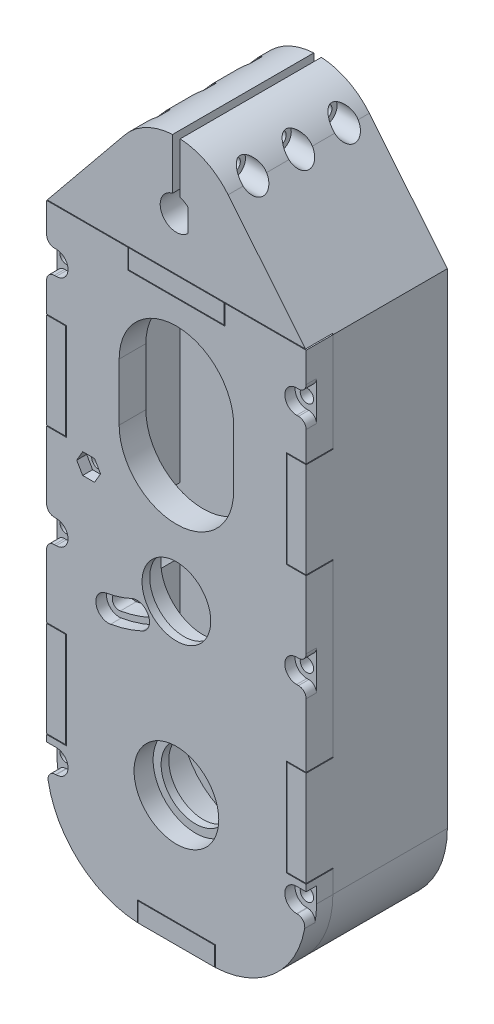
from build123d import *

# Parameters (mm, degrees)
SKETCH1_W                = 42
SKETCH1_H                = 42
BOSS_EXTRUDE1_DEPTH      = 7
SKETCH3_W                = 68
SKETCH3_H                = 152
SKETCH3_W_2              = 58
SKETCH3_H_2              = 142
BOSS_EXTRUDE2_DEPTH      = 30
CUT_EXTRUDE2_REACH       = 134.518
SKETCH4_R                = 9
SKETCH4_5_R              = 11.1
CUT_EXTRUDE3_DEPTH       = 5
CUT_EXTRUDE23_START      = 2
SKETCH4_7_R              = 11.1
SKETCH4_7_R_2            = 9
CUT_EXTRUDE23_DEPTH      = 131.517923316
SKETCH5_W                = 5
SKETCH5_H                = 25
SKETCH5_W_2              = 20
SKETCH5_H_2              = 5
SKETCH5_W_3              = 25
BOSS_EXTRUDE4_DEPTH      = 7
BOSS_EXTRUDE5_DEPTH      = 7
SKETCH8_R                = 9
CUT_EXTRUDE4_DEPTH       = 7
SKETCH8_3_R              = 11.1
SKETCH8_3_R_2            = 9
CUT_EXTRUDE5_DEPTH       = 5
CUT_EXTRUDE6_START       = -2
SKETCH8_4_R              = 11.1
SKETCH8_4_R_2            = 9
CUT_EXTRUDE6_DEPTH       = 5
SKETCH9_R                = 1.8
CUT_EXTRUDE7_DEPTH       = 7
CUT_EXTRUDE8_DEPTH       = 2.8
CUT_EXTRUDE9_DEPTH       = 2.6
CUT_EXTRUDE10_DEPTH      = 23
FILLET4_R                = 18
FILLET3_R                = 25
FILLET5_R                = 25
SKETCH14_R               = 1.75
CUT_EXTRUDE11_DEPTH      = 2.7
SKETCH14_2_R             = 1.75
CUT_EXTRUDE12_DEPTH      = 7
SKETCH15_R               = 1.5
CUT_EXTRUDE13_DEPTH      = 16
CUT_EXTRUDE14_DEPTH      = 7
FILLET6_R                = 2
BOSS_EXTRUDE12_DEPTH     = 29.9
BOSS_EXTRUDE13_DEPTH     = 7.1
BOSS_EXTRUDE14_START     = -37
BOSS_EXTRUDE14_DEPTH     = 37
CUT_EXTRUDE17_DEPTH      = 136.650285661
CUT_EXTRUDE17_DEPTH_BACK = 136.650285661
SKETCH23_R               = 1.75
CUT_EXTRUDE18_START      = 8
SKETCH23_3_R             = 3.1
SKETCH23_3_R_2           = 1.75
CUT_EXTRUDE18_DEPTH      = 128.650285689
CUT_EXTRUDE19_START      = -9
CUT_EXTRUDE19_DEPTH      = 127.650285689


with BuildPart() as part:
    # Sketch1 → Boss-Extrude1 (new body)
    # profile 1 of 2: a face of its own
    with BuildSketch(Plane.XY):
        Polygon((21, -21), (-21, -21), (-21, 21), (-29, 21), (-29, -121), (29, -121), (29, 21), (21, 21), align=None)
    # profile 2 of 2: a face of its own
    with BuildSketch(Plane.XY):
        Rectangle(SKETCH1_W, SKETCH1_H)
        with BuildLine():
            ThreePointArc((11.1, 3.5), (0, 14.6), (-11.1, 3.5))
            Line((-11.1, 3.5), (-11.1, -3.5))
            ThreePointArc((-11.1, -3.5), (0, -14.6), (11.1, -3.5))
            Line((11.1, -3.5), (11.1, 3.5))
        make_face(mode=Mode.SUBTRACT)
        with BuildLine():
            ThreePointArc((17.3, -12), (15.5, -10.2), (13.7, -12))
            Line((13.7, -12), (13.7, -19))
            ThreePointArc((13.7, -19), (15.5, -20.8), (17.3, -19))
            Line((17.3, -19), (17.3, -12))
        make_face(mode=Mode.SUBTRACT)
        with BuildLine():
            ThreePointArc((-13.7, -12), (-15.5, -10.2), (-17.3, -12))
            Line((-17.3, -12), (-17.3, -19))
            ThreePointArc((-17.3, -19), (-15.5, -20.8), (-13.7, -19))
            Line((-13.7, -19), (-13.7, -12))
        make_face(mode=Mode.SUBTRACT)
        with BuildLine():
            ThreePointArc((-13.7, 19), (-15.5, 20.8), (-17.3, 19))
            Line((-17.3, 19), (-17.3, 12))
            ThreePointArc((-17.3, 12), (-15.5, 10.2), (-13.7, 12))
            Line((-13.7, 12), (-13.7, 19))
        make_face(mode=Mode.SUBTRACT)
        with BuildLine():
            ThreePointArc((17.3, 19), (15.5, 20.8), (13.7, 19))
            Line((13.7, 19), (13.7, 12))
            ThreePointArc((13.7, 12), (15.5, 10.2), (17.3, 12))
            Line((17.3, 12), (17.3, 19))
        make_face(mode=Mode.SUBTRACT)
    extrude(amount=BOSS_EXTRUDE1_DEPTH)

    # Sketch3 → Boss-Extrude2 (add)
    with BuildSketch(Plane.XY):
        with Locations((0, -50)):
            Rectangle(SKETCH3_W, SKETCH3_H)
        with Locations((0, -50)):
            Rectangle(SKETCH3_W_2, SKETCH3_H_2, mode=Mode.SUBTRACT)
    extrude(amount=BOSS_EXTRUDE2_DEPTH)

    # Sketch4 → Cut-Extrude2 (cut, up to next)
    with BuildSketch(Plane(origin=(0, 0, 7), x_dir=(-1, 0, 0), z_dir=(0, 0, -1)), mode=Mode.PRIVATE) as cut_extrude2_sk1:
        with Locations(Location((0, -92, 0), (0, 0, 180))):
            Circle(SKETCH4_R)
    cut_extrude2_tool1 = extrude(cut_extrude2_sk1.sketch, amount=CUT_EXTRUDE2_REACH, mode=Mode.PRIVATE) & part.part
    # Sketch4 → Cut-Extrude2 (cut, up to next)
    with BuildSketch(Plane(origin=(0, 0, 7), x_dir=(-1, 0, 0), z_dir=(0, 0, -1)), mode=Mode.PRIVATE) as cut_extrude2_sk2:
        with Locations(Location((0, -48, 0), (0, 0, 180))):
            Circle(SKETCH4_R)
    cut_extrude2_tool2 = extrude(cut_extrude2_sk2.sketch, amount=CUT_EXTRUDE2_REACH, mode=Mode.PRIVATE) & part.part
    add(cut_extrude2_tool1.solids().sort_by_distance((0, -92, 7))[0], mode=Mode.SUBTRACT)
    add(cut_extrude2_tool2.solids().sort_by_distance((0, -48, 7))[0], mode=Mode.SUBTRACT)

    # Sketch4<5> → Cut-Extrude3 (cut)
    with BuildSketch(Plane(origin=(0, 0, 7), x_dir=(-1, 0, 0), z_dir=(0, 0, -1))):
        with Locations((0, -48)):
            Circle(SKETCH4_5_R)
    extrude(amount=CUT_EXTRUDE3_DEPTH, mode=Mode.SUBTRACT)

    # Sketch4<7> → Cut-Extrude23 (cut, through all)
    with BuildSketch(Plane(origin=(0, 0, 7), x_dir=(-1, 0, 0), z_dir=(0, 0, -1)).offset(CUT_EXTRUDE23_START)):
        with Locations(Location((0, -92, 0), (0, 0, 180))):
            Circle(SKETCH4_7_R)
        with Locations(Location((0, -92, 0), (0, 0, 180))):
            Circle(SKETCH4_7_R_2, mode=Mode.SUBTRACT)
    extrude(amount=CUT_EXTRUDE23_DEPTH, mode=Mode.SUBTRACT)

    # Sketch5 → Boss-Extrude4 (add)
    with BuildSketch(Plane.XY.offset(30)):
        with Locations((-31.5, -12.5)):
            Rectangle(SKETCH5_W, SKETCH5_H)
        with Locations((-31.5, -82.5)):
            Rectangle(SKETCH5_W, SKETCH5_H)
        with Locations((0, -123.5)):
            Rectangle(SKETCH5_W_2, SKETCH5_H_2)
        with Locations((31.5, -82.5)):
            Rectangle(SKETCH5_W, SKETCH5_H)
        with Locations((31.5, -12.5)):
            Rectangle(SKETCH5_W, SKETCH5_H)
        with Locations((0, 23.5)):
            Rectangle(SKETCH5_W_3, SKETCH5_H_2)
    extrude(amount=BOSS_EXTRUDE4_DEPTH)

    # Sketch12 → Cut-Extrude10 (cut)
    with BuildSketch(Plane.XY.offset(30)):
        with BuildLine():
            Line((-29, -50.5), (-29, -67.5))
            ThreePointArc((-29, -67.5), (-33.017879978, -59), (-29, -50.5))
        make_face()
    extrude(amount=-CUT_EXTRUDE10_DEPTH, mode=Mode.SUBTRACT)

    # Fillet4
    fillet4_edges = [part.edges().sort_by_distance(p)[0] for p in [
        (-29, -121, 18.5),
        (29, -121, 18.5),
    ]]
    fillet(fillet4_edges, radius=FILLET4_R)

    # Fillet3
    fillet3_edges = [part.edges().sort_by_distance(p)[0] for p in [
        (34, -126, 15),
        (-34, -126, 15),
    ]]
    fillet(fillet3_edges, radius=FILLET3_R)

    # Sketch15 → Cut-Extrude13 (cut)
    with BuildSketch(Plane.XY.offset(37)):
        with Locations((31.5, 13.1)):
            Circle(SKETCH15_R)
        with Locations((31.5, -48)):
            Circle(SKETCH15_R)
        with Locations((31.5, -100)):
            Circle(SKETCH15_R)
        with Locations((-31.5, -100)):
            Circle(SKETCH15_R)
        with Locations((-31.5, -48)):
            Circle(SKETCH15_R)
        with Locations((-31.5, 13.1)):
            Circle(SKETCH15_R)
    extrude(amount=-CUT_EXTRUDE13_DEPTH, mode=Mode.SUBTRACT)

    # Sketch20 → Boss-Extrude12 (add)
    with BuildSketch(Plane.XY):
        with BuildLine():
            ThreePointArc((-1, 57.47140521), (-7.955221873, 55.587316798), (-13.561630346, 51.060387984))
            ThreePointArc((-13.561630346, 51.060387984), (-17.370845552, 37.877801895), (-10.5, 26))
            Line((-10.5, 26), (10.5, 26))
            ThreePointArc((10.5, 26), (15.652475842, 32.173762079), (17.5, 40))
            ThreePointArc((17.5, 40), (16.486032437, 45.870326607), (13.561630346, 51.060387984))
            ThreePointArc((13.561630346, 51.060387984), (7.955221873, 55.587316798), (1, 57.47140521))
            Line((1, 57.47140521), (1, 44.13067791))
            ThreePointArc((1, 44.13067791), (3.340097304, 42.627974505), (4.25, 40))
            ThreePointArc((4.25, 40), (-2.627974505, 36.659902696), (-1, 44.13067791))
            Line((-1, 44.13067791), (-1, 57.47140521))
        make_face()
        with BuildLine():
            ThreePointArc((17.5, 40), (15.652475842, 32.173762079), (10.5, 26))
            Line((10.5, 26), (34, 26))
            Line((34, 26), (13.561630346, 51.060387984))
            ThreePointArc((13.561630346, 51.060387984), (16.486032437, 45.870326607), (17.5, 40))
        make_face()
        with BuildLine():
            Line((-13.561630346, 51.060387984), (-34, 26))
            Line((-34, 26), (-10.5, 26))
            ThreePointArc((-10.5, 26), (-17.370845552, 37.877801895), (-13.561630346, 51.060387984))
        make_face()
    extrude(amount=BOSS_EXTRUDE12_DEPTH)

    # Sketch21 → Boss-Extrude13 (add)
    with BuildSketch(Plane.XY.offset(29.9)):
        with BuildLine():
            Line((-33.836887045, 26.2), (33.836887045, 26.2))
            Line((33.836887045, 26.2), (13.561630346, 51.060387984))
            ThreePointArc((13.561630346, 51.060387984), (7.955221873, 55.587316798), (1, 57.47140521))
            Line((1, 57.47140521), (1, 44.13067791))
            ThreePointArc((1, 44.13067791), (0, 35.75), (-1, 44.13067791))
            Line((-1, 44.13067791), (-1, 57.47140521))
            ThreePointArc((-1, 57.47140521), (-7.955221873, 55.587316798), (-13.561630346, 51.060387984))
            Line((-13.561630346, 51.060387984), (-33.836887045, 26.2))
        make_face()
    extrude(amount=BOSS_EXTRUDE13_DEPTH)

    # Sketch22 → Boss-Extrude14 (add)
    with BuildSketch(Plane.XY.offset(37).offset(BOSS_EXTRUDE14_START)):
        with BuildLine():
            ThreePointArc((4.25, 40), (3.925079617, 41.629800601), (3, 43.010398645))
            Line((3, 43.010398645), (3, 36.989601355))
            ThreePointArc((3, 36.989601355), (3.925079617, 38.370199399), (4.25, 40))
        make_face()
    extrude(amount=BOSS_EXTRUDE14_DEPTH)

    # Sketch23 → Cut-Extrude17 (cut, two sides: drawn at the far end of the back side and taken through both)
    with BuildSketch(Plane(origin=(0, 0, 0), x_dir=(0, 0, -1), z_dir=(1, 0, 0)).offset(-CUT_EXTRUDE17_DEPTH_BACK)):
        with Locations(Location((-30, 51.47140521, 0), (0, 0, 346.4162178))):
            Circle(SKETCH23_R)
        with Locations(Location((-18, 51.47140521, 0), (0, 0, 346.4162178))):
            Circle(SKETCH23_R)
        with Locations(Location((-6, 51.47140521, 0), (0, 0, 346.4162178))):
            Circle(SKETCH23_R)
    extrude(amount=CUT_EXTRUDE17_DEPTH + CUT_EXTRUDE17_DEPTH_BACK, mode=Mode.SUBTRACT)

    # Sketch23<3> → Cut-Extrude18 (cut, through all)
    # profile 1 of 3: a face of its own
    with BuildSketch(Plane(origin=(0, 0, 0), x_dir=(0, 0, -1), z_dir=(1, 0, 0)).offset(CUT_EXTRUDE18_START)):
        with Locations(Location((-30, 51.47140521, 0), (0, 0, 187.619064708))):
            Circle(SKETCH23_3_R)
        with Locations((-30, 51.47140521)):
            Circle(SKETCH23_3_R_2, mode=Mode.SUBTRACT)
    # profile 2 of 3: a face of its own
    with BuildSketch(Plane(origin=(0, 0, 0), x_dir=(0, 0, -1), z_dir=(1, 0, 0)).offset(CUT_EXTRUDE18_START)):
        with Locations(Location((-6, 51.47140521, 0), (0, 0, 187.619064708))):
            Circle(SKETCH23_3_R)
        with Locations((-6, 51.47140521)):
            Circle(SKETCH23_3_R_2, mode=Mode.SUBTRACT)
    # profile 3 of 3: a face of its own
    with BuildSketch(Plane(origin=(0, 0, 0), x_dir=(0, 0, -1), z_dir=(1, 0, 0)).offset(CUT_EXTRUDE18_START)):
        with Locations(Location((-18, 51.47140521, 0), (0, 0, 187.619064708))):
            Circle(SKETCH23_3_R)
        with Locations((-18, 51.47140521)):
            Circle(SKETCH23_3_R_2, mode=Mode.SUBTRACT)
    extrude(amount=CUT_EXTRUDE18_DEPTH, mode=Mode.SUBTRACT)

    # Sketch24 → Cut-Extrude19 (cut, through all)
    with BuildSketch(Plane(origin=(0, 0, 0), x_dir=(0, 0, -1), z_dir=(1, 0, 0)).offset(CUT_EXTRUDE19_START)):
        Polygon((-28.383419246, 54.27140521), (-31.616580754, 54.27140521), (-33.233161507, 51.47140521), (-31.616580754, 48.67140521), (-28.383419246, 48.67140521), (-26.766838493, 51.47140521), align=None)
        Polygon((-16.383419246, 54.27140521), (-19.616580754, 54.27140521), (-21.233161507, 51.47140521), (-19.616580754, 48.67140521), (-16.383419246, 48.67140521), (-14.766838493, 51.47140521), align=None)
        Polygon((-4.383419246, 54.27140521), (-7.616580754, 54.27140521), (-9.233161507, 51.47140521), (-7.616580754, 48.67140521), (-4.383419246, 48.67140521), (-2.766838493, 51.47140521), align=None)
    extrude(amount=-CUT_EXTRUDE19_DEPTH, mode=Mode.SUBTRACT)


with BuildPart() as body_2:
    # Sketch7 → Boss-Extrude5 (new body)
    with BuildSketch(Plane.XY.offset(30)):
        Polygon((-34, -126), (-10.2, -126), (-10.2, -120.8), (10.2, -120.8), (10.2, -126), (34, -126), (34, -95.2), (28.8, -95.2), (28.8, -69.8), (34, -69.8), (34, -25.2), (28.8, -25.2), (28.8, 0.2), (34, 0.2), (34, 26), (12.7, 26), (12.7, 20.8), (-12.7, 20.8), (-12.7, 26), (-34, 26), (-34, 0.2), (-28.8, 0.2), (-28.8, -25.2), (-34, -25.2), (-34, -69.8), (-28.8, -69.8), (-28.8, -95.2), (-34, -95.2), align=None)
    extrude(amount=BOSS_EXTRUDE5_DEPTH)

    # Sketch8 → Cut-Extrude4 (cut)
    with BuildSketch(Plane.XY.offset(37)):
        with Locations((0, -92)):
            Circle(SKETCH8_R)
        with Locations((0, -48)):
            Circle(SKETCH8_R)
    extrude(amount=-CUT_EXTRUDE4_DEPTH, mode=Mode.SUBTRACT)

    # Sketch8<3> → Cut-Extrude5 (cut)
    with BuildSketch(Plane.XY.offset(37)):
        with Locations((0, -92)):
            Circle(SKETCH8_3_R)
        with Locations((0, -92)):
            Circle(SKETCH8_3_R_2, mode=Mode.SUBTRACT)
    extrude(amount=-CUT_EXTRUDE5_DEPTH, mode=Mode.SUBTRACT)

    # Sketch8<4> → Cut-Extrude6 (cut)
    with BuildSketch(Plane.XY.offset(37).offset(CUT_EXTRUDE6_START)):
        with Locations((0, -48)):
            Circle(SKETCH8_4_R)
        with Locations((0, -48)):
            Circle(SKETCH8_4_R_2, mode=Mode.SUBTRACT)
    extrude(amount=-CUT_EXTRUDE6_DEPTH, mode=Mode.SUBTRACT)

    # Sketch9 → Cut-Extrude7 (cut)
    with BuildSketch(Plane.XY.offset(37)):
        with BuildLine():
            ThreePointArc((-17.501162862, -60.320964068), (-13.46, -59.335266605), (-9.582069183, -57.83052432))
            ThreePointArc((-9.582069183, -57.83052432), (-8.70965823, -55.439102331), (-11.101080218, -54.566691378))
            ThreePointArc((-11.101080218, -54.566691378), (-14.54, -55.90108548), (-18.123672727, -56.775194551))
            ThreePointArc((-18.123672727, -56.775194551), (-19.585302553, -58.859334242), (-17.501162862, -60.320964068))
        make_face()
        with Locations((-23, -29)):
            Circle(SKETCH9_R)
    extrude(amount=-CUT_EXTRUDE7_DEPTH, mode=Mode.SUBTRACT)

    # Sketch10 → Cut-Extrude8 (cut)
    with BuildSketch(Plane.XY.offset(37)):
        with BuildLine():
            ThreePointArc((-17.241783752, -61.798368033), (-13.01, -60.766175407), (-8.949147918, -59.190454713))
            ThreePointArc((-8.949147918, -59.190454713), (-7.349727837, -54.806181066), (-11.734001483, -53.206760986))
            ThreePointArc((-11.734001483, -53.206760986), (-14.99, -54.470176678), (-18.383051837, -55.297790585))
            ThreePointArc((-18.383051837, -55.297790585), (-21.062706519, -59.118713352), (-17.241783752, -61.798368033))
        make_face()
    extrude(amount=-CUT_EXTRUDE8_DEPTH, mode=Mode.SUBTRACT)

    # Sketch11 → Cut-Extrude9 (cut)
    with BuildSketch(Plane.XY.offset(37)):
        Polygon((-21.441154273, -26.3), (-24.558845727, -26.3), (-26.117691454, -29), (-24.558845727, -31.7), (-21.441154273, -31.7), (-19.882308546, -29), align=None)
    extrude(amount=-CUT_EXTRUDE9_DEPTH, mode=Mode.SUBTRACT)

    # Fillet5
    # the kernel refuses this fillet: 25 mm, written as the material it takes off along each edge
    with BuildSketch(Plane(origin=(34, -126, -32.42795848), x_dir=(-1, 0, 0), z_dir=(0, 0, 1))) as fillet5_piece_1:
        with BuildLine():
            CenterArc((25, -24.971183392), FILLET5_R, 92.751254589, 87.248745411)
            Line((0, -24.971183392), (-0.5, -24.971183392))
            Line((-0.5, -24.971183392), (-0.5, 0))
            Line((-0.5, 0), (0, 0.5))
            ThreePointArc((0, 0.5), (11.9, 0.5), (23.776, 0.499423668))
            Line((23.776, 0.499423668), (23.8, 0))
        make_face()
    extrude(amount=131.85591696, mode=Mode.SUBTRACT)
    with BuildSketch(Plane(origin=(-34, -126, -32.42795848), x_dir=(0, 1, 0), z_dir=(0, 0, 1))) as fillet5_piece_2:
        with BuildLine():
            CenterArc((24.971183392, -25), FILLET5_R, 90, 87.248745411)
            Line((0, -23.8), (-0.499423668, -23.776))
            ThreePointArc((-0.499423668, -23.776), (-0.5, -11.9), (-0.5, 0))
            Line((-0.5, 0), (0, 0.5))
            Line((0, 0.5), (24.971183392, 0.5))
            Line((24.971183392, 0.5), (24.971183392, 0))
        make_face()
    extrude(amount=131.85591696, mode=Mode.SUBTRACT)

    # Sketch14 → Cut-Extrude11 (cut)
    # profile 1 of 6: a face of its own
    with BuildSketch(Plane.XY.offset(37)):
        with BuildLine():
            Line((31.5, -44.9), (36.5, -44.9))
            ThreePointArc((36.5, -44.9), (39.6, -48), (36.5, -51.1))
            Line((36.5, -51.1), (31.5, -51.1))
            ThreePointArc((31.5, -51.1), (28.4, -48), (31.5, -44.9))
        make_face()
        with Locations((31.5, -48)):
            Circle(SKETCH14_R, mode=Mode.SUBTRACT)
    # profile 2 of 6: a face of its own
    with BuildSketch(Plane.XY.offset(37)):
        with BuildLine():
            Line((31.5, -96.9), (36.5, -96.9))
            ThreePointArc((36.5, -96.9), (39.6, -100), (36.5, -103.1))
            Line((36.5, -103.1), (31.5, -103.1))
            ThreePointArc((31.5, -103.1), (28.4, -100), (31.5, -96.9))
        make_face()
        with Locations((31.5, -100)):
            Circle(SKETCH14_R, mode=Mode.SUBTRACT)
    # profile 3 of 6: a face of its own
    with BuildSketch(Plane.XY.offset(37)):
        with BuildLine():
            Line((-31.5, -44.9), (-36.5, -44.9))
            ThreePointArc((-36.5, -44.9), (-39.6, -48), (-36.5, -51.1))
            Line((-36.5, -51.1), (-31.5, -51.1))
            ThreePointArc((-31.5, -51.1), (-28.4, -48), (-31.5, -44.9))
        make_face()
        with Locations((-31.5, -48)):
            Circle(SKETCH14_R, mode=Mode.SUBTRACT)
    # profile 4 of 6: a face of its own
    with BuildSketch(Plane.XY.offset(37)):
        with BuildLine():
            Line((31.5, 16.2), (36.5, 16.2))
            ThreePointArc((36.5, 16.2), (39.6, 13.1), (36.5, 10))
            Line((36.5, 10), (31.5, 10))
            ThreePointArc((31.5, 10), (28.4, 13.1), (31.5, 16.2))
        make_face()
        with Locations((31.5, 13.1)):
            Circle(SKETCH14_R, mode=Mode.SUBTRACT)
    # profile 5 of 6: a face of its own
    with BuildSketch(Plane.XY.offset(37)):
        with BuildLine():
            Line((-31.5, -96.9), (-36.5, -96.9))
            ThreePointArc((-36.5, -96.9), (-39.6, -100), (-36.5, -103.1))
            Line((-36.5, -103.1), (-31.5, -103.1))
            ThreePointArc((-31.5, -103.1), (-28.4, -100), (-31.5, -96.9))
        make_face()
        with Locations((-31.5, -100)):
            Circle(SKETCH14_R, mode=Mode.SUBTRACT)
    # profile 6 of 6: a face of its own
    with BuildSketch(Plane.XY.offset(37)):
        with BuildLine():
            Line((-31.5, 16.2), (-36.5, 16.2))
            ThreePointArc((-36.5, 16.2), (-39.6, 13.1), (-36.5, 10))
            Line((-36.5, 10), (-31.5, 10))
            ThreePointArc((-31.5, 10), (-28.4, 13.1), (-31.5, 16.2))
        make_face()
        with Locations((-31.5, 13.1)):
            Circle(SKETCH14_R, mode=Mode.SUBTRACT)
    extrude(amount=-CUT_EXTRUDE11_DEPTH, mode=Mode.SUBTRACT)

    # Sketch14<2> → Cut-Extrude12 (cut)
    with BuildSketch(Plane.XY.offset(37)):
        with Locations((-31.5, -100)):
            Circle(SKETCH14_2_R)
        with Locations((-31.5, -48)):
            Circle(SKETCH14_2_R)
        with Locations((-31.5, 13.1)):
            Circle(SKETCH14_2_R)
        with Locations((31.5, 13.1)):
            Circle(SKETCH14_2_R)
        with Locations((31.5, -48)):
            Circle(SKETCH14_2_R)
        with Locations((31.5, -100)):
            Circle(SKETCH14_2_R)
    extrude(amount=-CUT_EXTRUDE12_DEPTH, mode=Mode.SUBTRACT)

    # Sketch16 → Cut-Extrude14 (cut)
    with BuildSketch(Plane.XY.offset(37)):
        with BuildLine():
            Line((15, -0.5), (15, -15.5))
            ThreePointArc((15, -15.5), (0, -30.5), (-15, -15.5))
            Line((-15, -15.5), (-15, -0.5))
            ThreePointArc((-15, -0.5), (0, 14.5), (15, -0.5))
        make_face()
    extrude(amount=-CUT_EXTRUDE14_DEPTH, mode=Mode.SUBTRACT)

    # Fillet6
    fillet6_edges = [body_2.edges().sort_by_distance(p)[0] for p in [
        (-33.914056261, -103.1, 35.65),
        (33.914056261, -103.1, 35.65),
        (-34, 10, 35.65),
        (-34, 16.2, 35.65),
        (-34, -51.1, 35.65),
        (-34, -44.9, 35.65),
        (34, 16.2, 35.65),
        (34, 10, 35.65),
        (34, -44.9, 35.65),
        (34, -51.1, 35.65),
    ]]
    fillet(fillet6_edges, radius=FILLET6_R)


solid = Compound([part.part, body_2.part])
